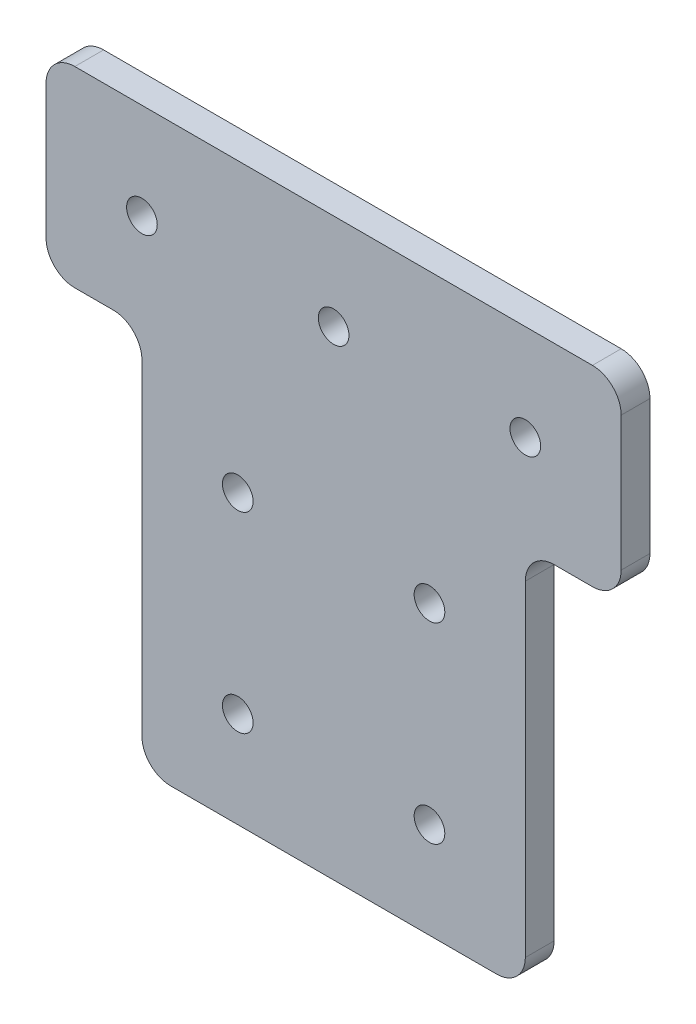
from build123d import *

# Parameters (mm, degrees)
EXTRUDE_1_DEPTH     = 3
CUT_EXTRUDE_1_REACH = 52.09
SKETCH_2_R          = 1.6
FILLET_1_R          = 3
FILLET_2_R          = 3


with BuildPart() as part:
    # 草图1 → 凸台-拉伸1 (new body)
    with BuildSketch(Plane.XY):
        Polygon((-20, 20), (-30, 20), (-30, 40), (30, 40), (30, 20), (20, 20), (20, -20), (-20, -20), align=None)
    extrude(amount=EXTRUDE_1_DEPTH)

    # 草图2 → 切除-拉伸1 (cut, up to next)
    with BuildSketch(Plane.XY.offset(3), mode=Mode.PRIVATE) as cut_extrude_1_sk1:
        with Locations((-20, 30)):
            Circle(SKETCH_2_R)
    cut_extrude_1_tool1 = extrude(cut_extrude_1_sk1.sketch, amount=-CUT_EXTRUDE_1_REACH, mode=Mode.PRIVATE) & part.part
    # 草图2 → 切除-拉伸1 (cut, up to next)
    with BuildSketch(Plane.XY.offset(3), mode=Mode.PRIVATE) as cut_extrude_1_sk2:
        with Locations((0, 30)):
            Circle(SKETCH_2_R)
    cut_extrude_1_tool2 = extrude(cut_extrude_1_sk2.sketch, amount=-CUT_EXTRUDE_1_REACH, mode=Mode.PRIVATE) & part.part
    # 草图2 → 切除-拉伸1 (cut, up to next)
    with BuildSketch(Plane.XY.offset(3), mode=Mode.PRIVATE) as cut_extrude_1_sk3:
        with Locations((20, 30)):
            Circle(SKETCH_2_R)
    cut_extrude_1_tool3 = extrude(cut_extrude_1_sk3.sketch, amount=-CUT_EXTRUDE_1_REACH, mode=Mode.PRIVATE) & part.part
    # 草图2 → 切除-拉伸1 (cut, up to next)
    with BuildSketch(Plane.XY.offset(3), mode=Mode.PRIVATE) as cut_extrude_1_sk4:
        with Locations((-10, -10)):
            Circle(SKETCH_2_R)
    cut_extrude_1_tool4 = extrude(cut_extrude_1_sk4.sketch, amount=-CUT_EXTRUDE_1_REACH, mode=Mode.PRIVATE) & part.part
    # 草图2 → 切除-拉伸1 (cut, up to next)
    with BuildSketch(Plane.XY.offset(3), mode=Mode.PRIVATE) as cut_extrude_1_sk5:
        with Locations((10, -10)):
            Circle(SKETCH_2_R)
    cut_extrude_1_tool5 = extrude(cut_extrude_1_sk5.sketch, amount=-CUT_EXTRUDE_1_REACH, mode=Mode.PRIVATE) & part.part
    # 草图2 → 切除-拉伸1 (cut, up to next)
    with BuildSketch(Plane.XY.offset(3), mode=Mode.PRIVATE) as cut_extrude_1_sk6:
        with Locations((10, 10)):
            Circle(SKETCH_2_R)
    cut_extrude_1_tool6 = extrude(cut_extrude_1_sk6.sketch, amount=-CUT_EXTRUDE_1_REACH, mode=Mode.PRIVATE) & part.part
    # 草图2 → 切除-拉伸1 (cut, up to next)
    with BuildSketch(Plane.XY.offset(3), mode=Mode.PRIVATE) as cut_extrude_1_sk7:
        with Locations((-10, 10)):
            Circle(SKETCH_2_R)
    cut_extrude_1_tool7 = extrude(cut_extrude_1_sk7.sketch, amount=-CUT_EXTRUDE_1_REACH, mode=Mode.PRIVATE) & part.part
    add(cut_extrude_1_tool1.solids().sort_by_distance((-20, 30, 3))[0], mode=Mode.SUBTRACT)
    add(cut_extrude_1_tool2.solids().sort_by_distance((0, 30, 3))[0], mode=Mode.SUBTRACT)
    add(cut_extrude_1_tool3.solids().sort_by_distance((20, 30, 3))[0], mode=Mode.SUBTRACT)
    add(cut_extrude_1_tool4.solids().sort_by_distance((-10, -10, 3))[0], mode=Mode.SUBTRACT)
    add(cut_extrude_1_tool5.solids().sort_by_distance((10, -10, 3))[0], mode=Mode.SUBTRACT)
    add(cut_extrude_1_tool6.solids().sort_by_distance((10, 10, 3))[0], mode=Mode.SUBTRACT)
    add(cut_extrude_1_tool7.solids().sort_by_distance((-10, 10, 3))[0], mode=Mode.SUBTRACT)

    # 圆角1
    fillet_1_edges = [part.edges().sort_by_distance(p)[0] for p in [
        (20, -20, 1.5),
        (-20, -20, 1.5),
        (-30, 20, 1.5),
        (30, 20, 1.5),
        (30, 40, 1.5),
        (-30, 40, 1.5),
    ]]
    fillet(fillet_1_edges, radius=FILLET_1_R)

    # 圆角2
    fillet_2_edges = [part.edges().sort_by_distance(p)[0] for p in [
        (-20, 20, 1.5),
        (20, 20, 1.5),
    ]]
    fillet(fillet_2_edges, radius=FILLET_2_R)


solid = part.part
